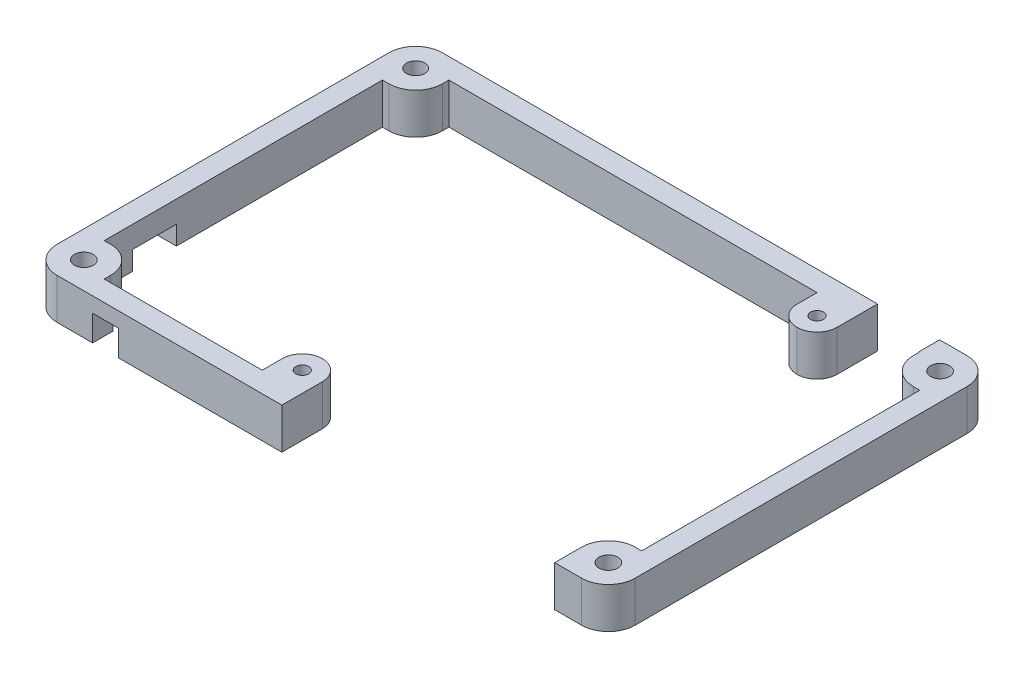
from build123d import *

# Parameters (mm, degrees)
BOSS_EXTRUDE3_DEPTH = 6.35
SKETCH3_W           = 9.663283239
SKETCH3_H           = 6.35
CUT_EXTRUDE1_DEPTH  = 3.175
SKETCH4_W           = 42.475
SKETCH4_H           = 6.35
CUT_EXTRUDE2_DEPTH  = 8.35
SKETCH5_W           = 6.8
SKETCH5_H           = 5.9
CUT_EXTRUDE3_DEPTH  = 3.175
SKETCH6_R           = 1.4732
CUT_EXTRUDE4_DEPTH  = 6.35
SKETCH7_R           = 1.4224
SKETCH7_R_2         = 1.4732
CUT_EXTRUDE5_DEPTH  = 6.35
SKETCH8_W           = 6.24
SKETCH8_H           = 6.35
BOSS_EXTRUDE4_DEPTH = 6.24
SKETCH9_W           = 6.24
SKETCH9_H           = 6.35
BOSS_EXTRUDE5_DEPTH = 6.24
SKETCH10_R          = 1
CUT_EXTRUDE6_DEPTH  = 55.454774814
FILLET1_R           = 3.12
SKETCH11_W          = 4
SKETCH11_H          = 4
CUT_EXTRUDE7_DEPTH  = 10


with BuildPart() as part:
    # Sketch2 → Boss-Extrude3 (new body)
    with BuildSketch(Plane(origin=(0, 0, 0), x_dir=(1, 0, 0), z_dir=(0, 1, 0))):
        with BuildLine():
            Line((-45, 25.825), (-45, -25.825))
            ThreePointArc((-45, -25.825), (-43.777170811, -28.777170811), (-40.825, -30))
            Line((-40.825, -30), (40.825, -30))
            ThreePointArc((40.825, -30), (43.777170811, -28.777170811), (45, -25.825))
            Line((45, -25.825), (45, 25.825))
            ThreePointArc((45, 25.825), (43.777170811, 28.777170811), (40.825, 30))
            Line((40.825, 30), (-40.825, 30))
            ThreePointArc((-40.825, 30), (-43.777170811, 28.777170811), (-45, 25.825))
        make_face()
        with BuildLine():
            Line((40.825, 21.65), (41.825, 21.65))
            Line((41.825, 21.65), (41.825, -21.65))
            Line((41.825, -21.65), (40.825, -21.65))
            ThreePointArc((40.825, -21.65), (37.872829189, -22.872829189), (36.65, -25.825))
            Line((36.65, -25.825), (36.65, -26.825))
            Line((36.65, -26.825), (-36.65, -26.825))
            Line((-36.65, -26.825), (-36.65, -25.825))
            ThreePointArc((-36.65, -25.825), (-37.872829189, -22.872829189), (-40.825, -21.65))
            Line((-40.825, -21.65), (-41.825, -21.65))
            Line((-41.825, -21.65), (-41.825, 21.65))
            Line((-41.825, 21.65), (-40.825, 21.65))
            ThreePointArc((-40.825, 21.65), (-37.872829189, 22.872829189), (-36.65, 25.825))
            Line((-36.65, 25.825), (-36.65, 26.825))
            Line((-36.65, 26.825), (36.65, 26.825))
            Line((36.65, 26.825), (36.65, 25.825))
            ThreePointArc((36.65, 25.825), (37.872829189, 22.872829189), (40.825, 21.65))
        make_face(mode=Mode.SUBTRACT)
    extrude(amount=BOSS_EXTRUDE3_DEPTH)

    # Sketch3 → Cut-Extrude1 (cut)
    with BuildSketch(Plane(origin=(0, 0, -30), x_dir=(-1, 0, 0), z_dir=(0, 0, -1))):
        with Locations((-31.734329903, 3.175)):
            Rectangle(SKETCH3_W, SKETCH3_H)
    extrude(amount=-CUT_EXTRUDE1_DEPTH, mode=Mode.SUBTRACT)

    # Sketch4 → Cut-Extrude2 (cut)
    with BuildSketch(Plane.XY.offset(30)):
        with Locations((15.4125, 3.175)):
            Rectangle(SKETCH4_W, SKETCH4_H)
    extrude(amount=-CUT_EXTRUDE2_DEPTH, mode=Mode.SUBTRACT)


with BuildPart() as cut_extrude2_piece_1:
    # of the separate pieces the step leaves, piece 1, a body of its own (cut_extrude2_pieces)
    add(part.part.solids().sort_by_distance((-40.825, 0, 30))[0])

    # Sketch5 → Cut-Extrude3 (cut)
    with BuildSketch(Plane.ZY.offset(45)):
        with Locations((13.825, 0)):
            Rectangle(SKETCH5_W, SKETCH5_H)
    extrude(amount=-CUT_EXTRUDE3_DEPTH, mode=Mode.SUBTRACT)

    # Sketch7 → Cut-Extrude5 (cut)
    with BuildSketch(Plane.XZ):
        with Locations(Location((-40.825, -25.825, 0), (0, 0, 270))):
            Circle(SKETCH7_R)
        with Locations(Location((-40.825, 25.825, 0), (0, 0, 270))):
            Circle(SKETCH7_R_2)
    extrude(amount=-CUT_EXTRUDE5_DEPTH, mode=Mode.SUBTRACT)

    # Sketch8 → Boss-Extrude4 (add)
    with BuildSketch(Plane(origin=(0, 0, 26.825), x_dir=(-1, 0, 0), z_dir=(0, 0, -1))):
        with Locations((8.945, 3.175)):
            Rectangle(SKETCH8_W, SKETCH8_H)
    extrude(amount=BOSS_EXTRUDE4_DEPTH)

    # Sketch9 → Boss-Extrude5 (add)
    with BuildSketch(Plane.XY.offset(-26.825)):
        with Locations((23.782688283, 3.175)):
            Rectangle(SKETCH9_W, SKETCH9_H)
    extrude(amount=BOSS_EXTRUDE5_DEPTH)

    # Sketch10 → Cut-Extrude6 (cut, through all)
    with BuildSketch(Plane(origin=(0, 0, 0), x_dir=(-1, 0, 0), z_dir=(0, -1, 0))):
        with Locations(Location((-23.782688283, 23.705, 0), (0, 0, 90))):
            Circle(SKETCH10_R)
        with Locations(Location((8.945, -23.705, 0), (0, 0, 90))):
            Circle(SKETCH10_R)
    extrude(amount=-CUT_EXTRUDE6_DEPTH, mode=Mode.SUBTRACT)

    # Fillet1
    fillet1_edges = [cut_extrude2_piece_1.edges().sort_by_distance(p)[0] for p in [
        (-12.065, 3.175, 20.585),
        (-5.825, 3.175, 20.585),
        (26.902688283, 3.175, -20.585),
        (20.662688283, 3.175, -20.585),
    ]]
    fillet(fillet1_edges, radius=FILLET1_R - 0.0001)  # a hair under: the kernel refuses the full size

    # Sketch11 → Cut-Extrude7 (cut)
    with BuildSketch(Plane.XY.offset(30)):
        with Locations((-33.285, 2)):
            Rectangle(SKETCH11_W, SKETCH11_H)
    extrude(amount=-CUT_EXTRUDE7_DEPTH, mode=Mode.SUBTRACT)


with BuildPart() as cut_extrude2_piece_2:
    # of the separate pieces the step leaves, piece 2, a body of its own (cut_extrude2_pieces)
    add(part.part.solids().sort_by_distance((40.825, 0, -30))[0])

    # Sketch6 → Cut-Extrude4 (cut)
    with BuildSketch(Plane.XZ):
        with Locations(Location((40.825, 25.825, 0), (0, 0, 270))):
            Circle(SKETCH6_R)
        with Locations(Location((40.825, -25.81487963, 0), (0, 0, 270))):
            Circle(SKETCH6_R)
    extrude(amount=-CUT_EXTRUDE4_DEPTH, mode=Mode.SUBTRACT)


solid = Compound([cut_extrude2_piece_1.part, cut_extrude2_piece_2.part])
